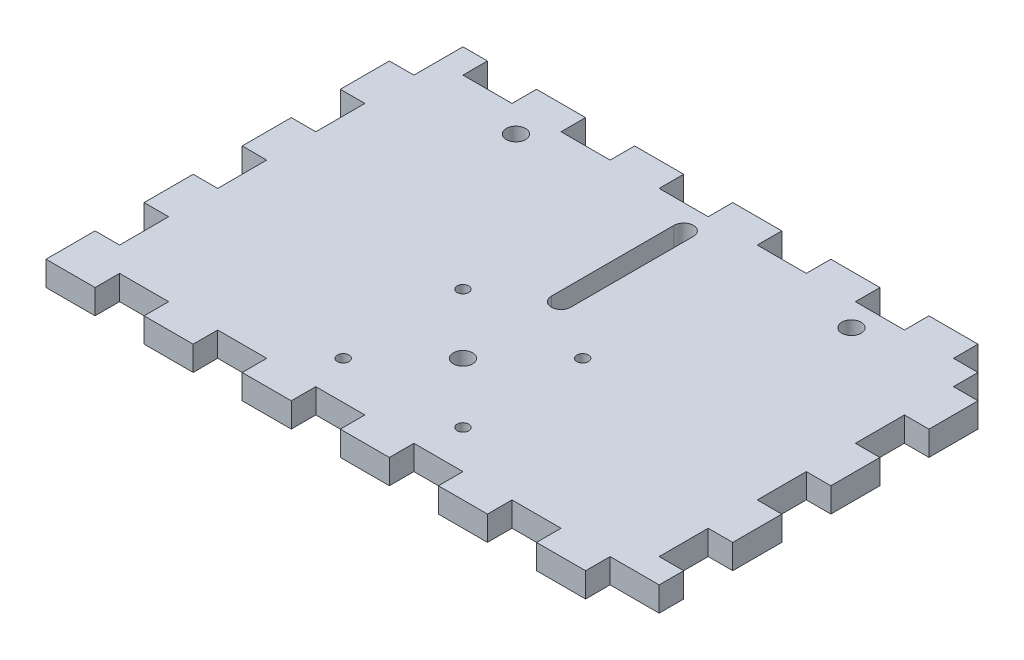
from build123d import *

# Parameters (mm, degrees)
SKETCH1_W             = 152.4
SKETCH1_H             = 101.6
BOSS_EXTRUDE2_DEPTH   = 6.35
SKETCH2_W             = 6.35
SKETCH2_H             = 12.7
CUT_EXTRUDE2_DEPTH    = 6.35
SKETCH2_4_W           = 12.7
SKETCH2_4_H           = 6.35
CUT_EXTRUDE3_DEPTH    = 6.35
F_5_0MM_DOWEL_HOLE1_D = 5
F_3_0MM_DOWEL_HOLE1_D = 3
F_5_0MM_DOWEL_HOLE2_D = 5
CUT_EXTRUDE5_DEPTH    = 184.272045059


with BuildPart() as part:
    # Sketch1 → Boss-Extrude2 (new body)
    with BuildSketch(Plane(origin=(0, 0, 0), x_dir=(1, 0, 0), z_dir=(0, 1, 0))):
        with Locations((76.2, 50.8)):
            Rectangle(SKETCH1_W, SKETCH1_H)
    extrude(amount=BOSS_EXTRUDE2_DEPTH)

    # Sketch2 → Cut-Extrude2 (cut)
    with BuildSketch(Plane(origin=(0, 6.35, 0), x_dir=(1, 0, 0), z_dir=(0, 1, 0))):
        with Locations((3.175, 95.25)):
            Rectangle(SKETCH2_W, SKETCH2_H)
        with Locations((3.175, 69.85)):
            Rectangle(SKETCH2_W, SKETCH2_H)
        with Locations((3.175, 44.45)):
            Rectangle(SKETCH2_W, SKETCH2_H)
        with Locations((3.175, 19.05)):
            Rectangle(SKETCH2_W, SKETCH2_H)
    cut_extrude2 = extrude(amount=-CUT_EXTRUDE2_DEPTH, mode=Mode.SUBTRACT)

    # Mirror1: Cut-Extrude2 across plane
    add(cut_extrude2.mirror(Plane.ZY.offset(-76.2)), mode=Mode.SUBTRACT)

    # Sketch2<4> → Cut-Extrude3 (cut)
    with BuildSketch(Plane(origin=(0, 6.35, 0), x_dir=(1, 0, 0), z_dir=(0, 1, 0))):
        with Locations((19.05, 98.425)):
            Rectangle(SKETCH2_4_W, SKETCH2_4_H)
        with Locations((44.45, 98.425)):
            Rectangle(SKETCH2_4_W, SKETCH2_4_H)
        with Locations((69.85, 98.425)):
            Rectangle(SKETCH2_4_W, SKETCH2_4_H)
        with Locations((95.25, 98.425)):
            Rectangle(SKETCH2_4_W, SKETCH2_4_H)
        with Locations((146.05, 98.425)):
            Rectangle(SKETCH2_4_W, SKETCH2_4_H)
        with Locations((120.65, 98.425)):
            Rectangle(SKETCH2_4_W, SKETCH2_4_H)
    cut_extrude3 = extrude(amount=-CUT_EXTRUDE3_DEPTH, mode=Mode.SUBTRACT)

    # Mirror2: Cut-Extrude3 across plane
    add(cut_extrude3.mirror(Plane(origin=(0, 0, -50.8), x_dir=(1, 0, 0), z_dir=(0, 0, -1))), mode=Mode.SUBTRACT)

    # Ø5.0mm Dowel Hole1 (through all)
    with Locations(Plane(origin=(0, 6.35, 0), x_dir=(1, 0, 0), z_dir=(0, 1, 0))):
        with Locations((76.2, 31.75)):
            Hole(F_5_0MM_DOWEL_HOLE1_D / 2)

    # Ø3.0mm Dowel Hole1 (through all)
    with Locations(Plane(origin=(0, 0, 0), x_dir=(-1, 0, 0), z_dir=(0, -1, 0))):
        with Locations((-60.7, 47.25), (-91.7, 47.25), (-91.7, 16.25), (-60.7, 16.25)):
            Hole(F_3_0MM_DOWEL_HOLE1_D / 2)

    # Ø5.0mm Dowel Hole2 (through all)
    with Locations(Plane(origin=(0, 6.35, 0), x_dir=(1, 0, 0), z_dir=(0, 1, 0))):
        with Locations((32.766, 88.9), (119.634, 88.9)):
            Hole(F_5_0MM_DOWEL_HOLE2_D / 2)

    # Sketch11 → Cut-Extrude5 (cut, through all)
    with BuildSketch(Plane(origin=(0, 6.35, 0), x_dir=(1, 0, 0), z_dir=(0, 1, 0))):
        with BuildLine():
            Line((78.7, 88.9), (78.7, 57.15))
            ThreePointArc((78.7, 57.15), (76.2, 54.65), (73.7, 57.15))
            Line((73.7, 57.15), (73.7, 88.9))
            ThreePointArc((73.7, 88.9), (76.2, 91.4), (78.7, 88.9))
        make_face()
    extrude(amount=-CUT_EXTRUDE5_DEPTH, mode=Mode.SUBTRACT)


solid = part.part
